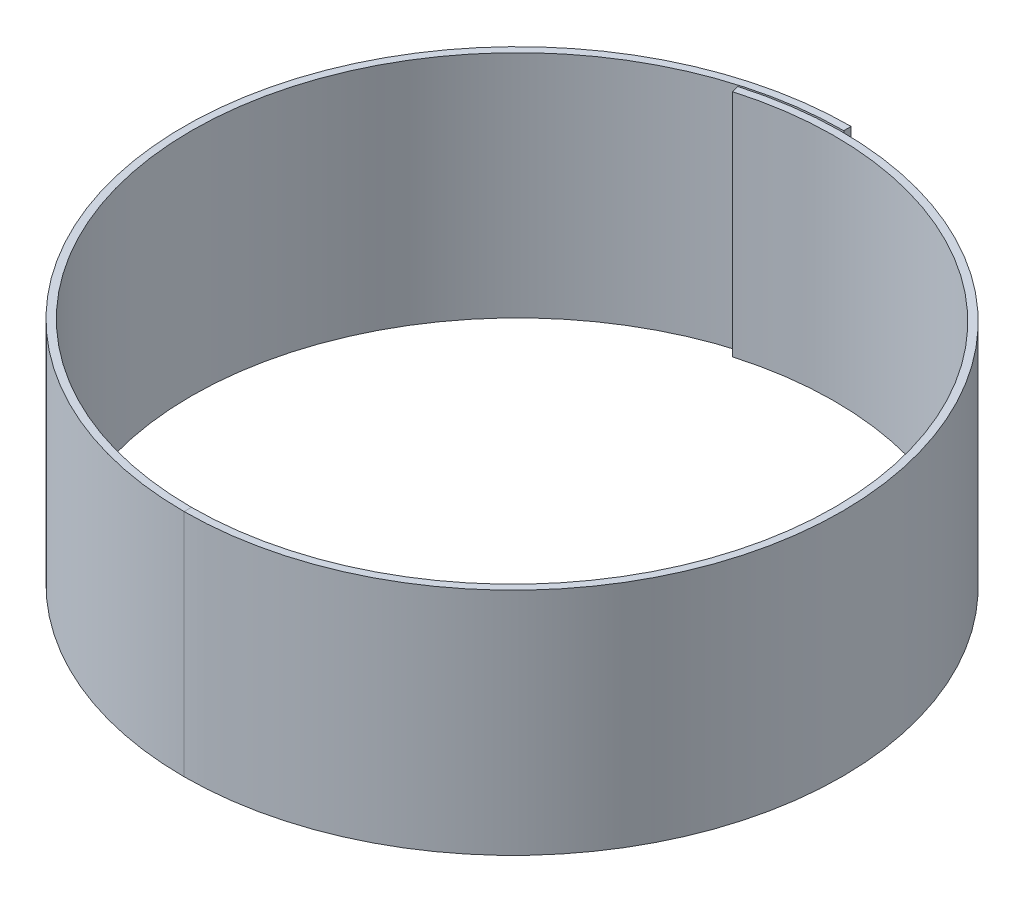
from build123d import *

# Parameters (mm, degrees)
BASE_FLANGE2_DEPTH = 25


# Sheet-metal steps are written as plain solids
with BuildPart() as part:
    # Sketch2 → Base-Flange2 (new body)
    with BuildSketch(Plane(origin=(0, 0, 0), x_dir=(1, 0, 0), z_dir=(0, 1, 0))):
        with BuildLine():
            ThreePointArc((0, 35.5), (-35.5, 0), (0, -35.5))
            ThreePointArc((0, -35.5), (34.654545156, 4.405354218), (-9.713875385, 33.125))
            Line((-9.713875385, 33.125), (-9.935906823, 33.893571429))
            ThreePointArc((-9.935906823, 33.893571429), (35.446649046, 4.5174766), (0, -36.3))
            ThreePointArc((0, -36.3), (-36.3, 0), (0, 36.3))
            Line((0, 36.3), (0, 35.5))
        make_face()
    extrude(amount=BASE_FLANGE2_DEPTH)


solid = part.part
